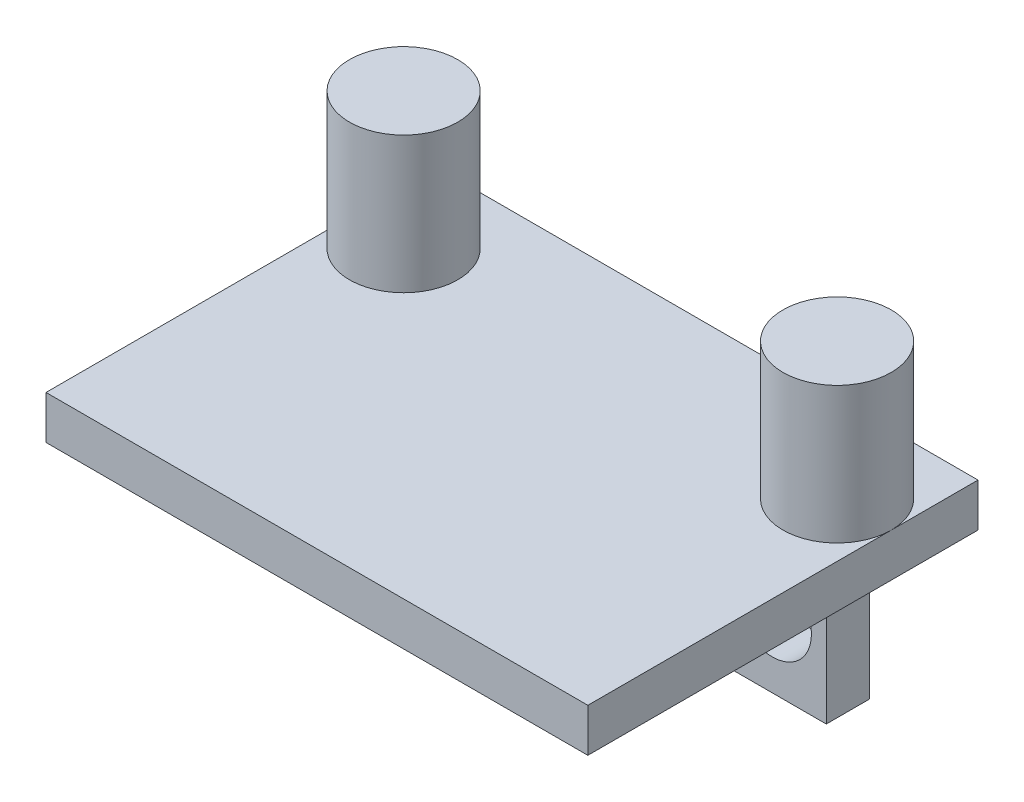
from build123d import *

# Parameters (mm, degrees)
BOSS_EXTRUDE1_DEPTH = 30
SKETCH2_R           = 3.625
CUT_EXTRUDE1_DEPTH  = 53.821779702
SKETCH3_W           = 36
SKETCH3_H           = 3.997849999
BOSS_EXTRUDE2_DEPTH = 10
SKETCH4_W           = 36
SKETCH4_H           = 4
BOSS_EXTRUDE3_DEPTH = 10
SKETCH5_R           = 5
BOSS_EXTRUDE4_DEPTH = 12.6


with BuildPart() as part:
    # Sketch1 → Boss-Extrude1 (new body)
    with BuildSketch(Plane(origin=(0, 0, 0), x_dir=(0, 0, -1), z_dir=(1, 0, 0))):
        Polygon((16.698859865, -1.874995608), (-15.301140135, -1.874995608), (-15.301140135, -5.874995608), (-6.301140135, -5.874995608), (-5.301140135, -6.674995608), (6.198859865, -6.674995608), (7.198859865, -5.874995608), (16.198859865, -5.874995608), (17.698859865, -6.874995608), (17.698859865, -12.374995608), (16.698859865, -13.374995608), (16.698859865, -24.374995608), (20.698859865, -24.374995608), (20.698859865, -1.874995608), align=None)
    extrude(amount=BOSS_EXTRUDE1_DEPTH)

    # Sketch2 → Cut-Extrude1 (cut, through all)
    with BuildSketch(Plane(origin=(0, 0, -20.698859865), x_dir=(-1, 0, 0), z_dir=(0, 0, -1))):
        with Locations((-25, -17.874995608)):
            Circle(SKETCH2_R)
        with Locations((-5, -17.874995608)):
            Circle(SKETCH2_R)
    extrude(amount=-CUT_EXTRUDE1_DEPTH, mode=Mode.SUBTRACT)

    # Sketch3 → Boss-Extrude2 (add)
    with BuildSketch(Plane.ZY):
        with Locations((-2.698859865, -3.873920608)):
            Rectangle(SKETCH3_W, SKETCH3_H)
    extrude(amount=BOSS_EXTRUDE2_DEPTH)

    # Sketch4 → Boss-Extrude3 (add)
    with BuildSketch(Plane(origin=(30, 0, 0), x_dir=(0, 0, -1), z_dir=(1, 0, 0))):
        with Locations((2.698859865, -3.874995608)):
            Rectangle(SKETCH4_W, SKETCH4_H)
    extrude(amount=BOSS_EXTRUDE3_DEPTH)

    # Sketch5 → Boss-Extrude4 (add)
    with BuildSketch(Plane(origin=(0, -1.874995608, 0), x_dir=(1, 0, 0), z_dir=(0, 1, 0))):
        with Locations((35, 12.698859865)):
            Circle(SKETCH5_R)
        with Locations((-5, 12.698859865)):
            Circle(SKETCH5_R)
    extrude(amount=BOSS_EXTRUDE4_DEPTH)


solid = part.part
